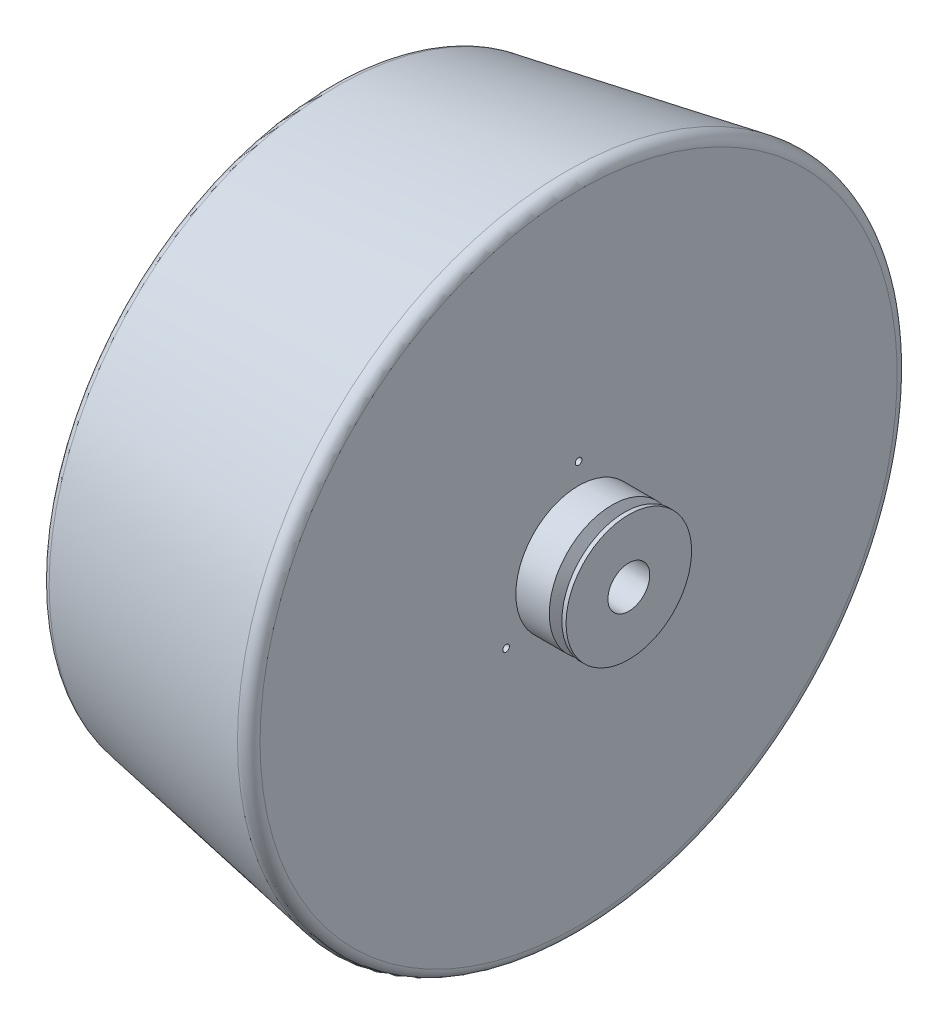
from build123d import *

# Parameters (mm, degrees)
FILLET1_R              = 6.35
F_1_1_DIAMETER_HOLE1_D = 25.4
CIRPATTERN1_COUNT      = 20
CIRPATTERN2_COUNT      = 3


# Read off the part's stored shape, not the designer's step: 1 (1) Diameter Hole2
with BuildPart() as part:
    # Sketch1 → Revolve1 (revolve)
    with BuildSketch(Plane.XY, mode=Mode.PRIVATE) as revolve1_sk:
        Polygon((0, 0), (170.18, 0), (170.18, 38.1), (167.64, 38.1), (163.83, 30.235073206), (160.02, 38.1), (139.7, 38.1), (139.7, 200.960647345), (-12.779200985, 174.074450215), (0, 101.6), align=None)
    revolve(revolve1_sk.sketch.rotate(Axis((0, 0, 0), (1, 0, 0)), 90), axis=Axis((0, 0, 0), (1, 0, 0)))

    # Fillet1
    fillet1_edges = [part.edges().sort_by_distance(p)[0] for p in [
        (139.7, 0, -200.960647345),
        (-12.779200985, 0, -174.074450215),
    ]]
    fillet(fillet1_edges, radius=FILLET1_R)

    # 1 (1) Diameter Hole1 (through all)
    with Locations(Plane(origin=(0, 0, 0), x_dir=(0, 0, -1), z_dir=(-1, 0, 0))):
        with Locations((0, 0)):
            Hole(F_1_1_DIAMETER_HOLE1_D / 2)

    # 1 (1) Diameter Hole2 outline → 1 (1) Diameter Hole2 (revolve, cut)
    with BuildSketch(Plane(origin=(-24.092681246, 136.636385136, 0), x_dir=(-0.173648177666925, 0.984807753012209, 0), z_dir=(0, 0, -1))):
        Polygon((12.7, 17.542393676), (12.7, 157.342654851), (0, 164.973584713), (0, 17.542393676), align=None)
    f_1_1_diameter_hole2 = revolve(axis=Axis((-24.092681246, 136.636385136, 0), (0.984807753012209, 0.173648177666925, 0)), mode=Mode.SUBTRACT)

    # CirPattern1: 1 (1) Diameter Hole2 ×20 about axis
    cirpattern1_axis = Axis((0, 0, 0), (-1, 0, 0))
    for i in range(1, CIRPATTERN1_COUNT):
        add(f_1_1_diameter_hole2.rotate(cirpattern1_axis, i * 360 / CIRPATTERN1_COUNT), mode=Mode.SUBTRACT)

    # Sketch6 → #10-32 Tapped Hole1 (revolve, cut)
    with BuildSketch(Plane(origin=(139.7, 50.8, 0), x_dir=(0, 0, -1), z_dir=(0, 1, 0))):
        Polygon((0, 0), (0, 14.827717848), (2.0193, 13.6144), (2.0193, 0), align=None)
    f_10_32_tapped_hole1 = revolve(axis=Axis((146.05, 50.8, 0), (-1, 0, 0)), mode=Mode.SUBTRACT)

    # CirPattern2: #10-32 Tapped Hole1 ×3 about axis
    cirpattern2_axis = Axis((0, 0, 0), (1, 0, 0))
    for i in range(1, CIRPATTERN2_COUNT):
        add(f_10_32_tapped_hole1.rotate(cirpattern2_axis, i * 360 / CIRPATTERN2_COUNT), mode=Mode.SUBTRACT)


solid = part.part
